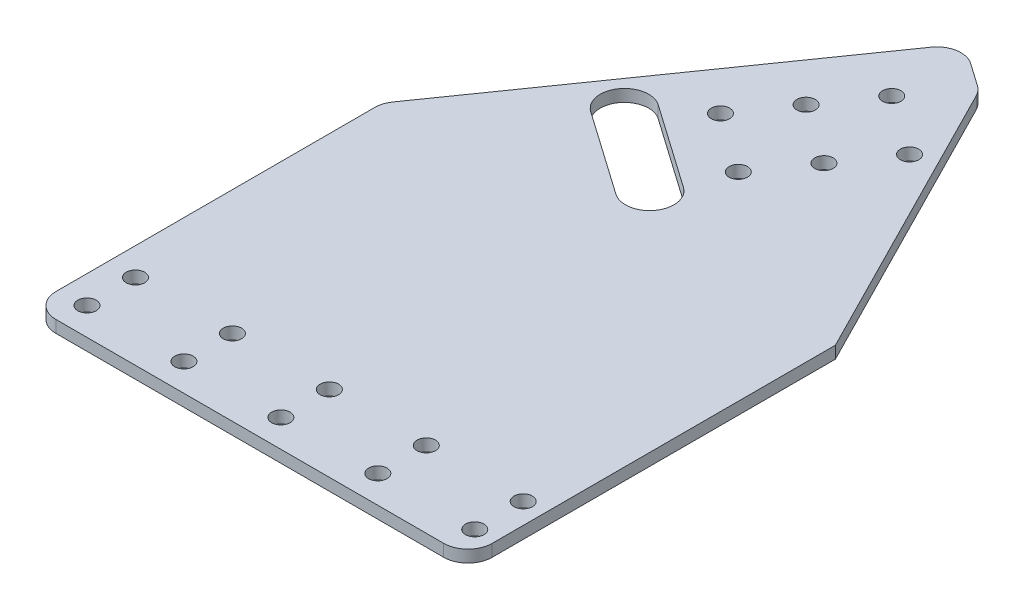
from build123d import *

# Parameters (mm, degrees)
SKETCH1_W           = 114.3
SKETCH1_H           = 181.61
BOSS_EXTRUDE1_DEPTH = 3.175
SKETCH2_R           = 2.413
CUT_EXTRUDE1_DEPTH  = 215.608393883
CUT_EXTRUDE3_DEPTH  = 215.608393883
CUT_EXTRUDE4_DEPTH  = 215.608393883
SKETCH3_R           = 2.413
CUT_EXTRUDE2_DEPTH  = 215.608393883
CUT_EXTRUDE5_DEPTH  = 215.608393883
FILLET1_R           = 6.35


with BuildPart() as part:
    # Sketch1 → Boss-Extrude1 (new body)
    with BuildSketch(Plane(origin=(0, 0, 0), x_dir=(1, 0, 0), z_dir=(0, 1, 0))):
        with Locations((57.15, 90.805)):
            Rectangle(SKETCH1_W, SKETCH1_H)
    extrude(amount=BOSS_EXTRUDE1_DEPTH)

    # Sketch2 → Cut-Extrude1 (cut, through all)
    with BuildSketch(Plane(origin=(0, 3.175, 0), x_dir=(1, 0, 0), z_dir=(0, 1, 0))):
        with Locations((7.239, 7.239)):
            Circle(SKETCH2_R)
        with Locations((7.239, 19.939)):
            Circle(SKETCH2_R)
        with Locations((32.639, 19.939)):
            Circle(SKETCH2_R)
        with Locations((58.039, 19.939)):
            Circle(SKETCH2_R)
        with Locations((83.439, 19.939)):
            Circle(SKETCH2_R)
        with Locations((108.839, 19.939)):
            Circle(SKETCH2_R)
        with Locations((32.639, 7.239)):
            Circle(SKETCH2_R)
        with Locations((58.039, 7.239)):
            Circle(SKETCH2_R)
        with Locations((83.439, 7.239)):
            Circle(SKETCH2_R)
        with Locations((108.839, 7.239)):
            Circle(SKETCH2_R)
    extrude(amount=-CUT_EXTRUDE1_DEPTH, mode=Mode.SUBTRACT)

    # Sketch4 → Cut-Extrude3 (cut, through all)
    with BuildSketch(Plane.XZ):
        Polygon((0, -181.61), (62.828519019, -181.61), (0, -91.881575796), align=None)
        Polygon((114.3, -145.569281014), (62.828519019, -181.61), (114.3, -181.61), align=None)
    extrude(amount=-CUT_EXTRUDE3_DEPTH, mode=Mode.SUBTRACT)

    # Sketch5 → Cut-Extrude4 (cut, through all)
    with BuildSketch(Plane.XZ):
        Polygon((75.39921929, -172.80790091), (114.3, -96.279640507), (114.3, -145.569281014), align=None)
    extrude(amount=-CUT_EXTRUDE4_DEPTH, mode=Mode.SUBTRACT)

    # Sketch3 → Cut-Extrude2 (cut, through all)
    with BuildSketch(Plane.XZ):
        with Locations((65.131472201, -160.203910247)):
            Circle(SKETCH3_R)
        with Locations((55.889406028, -147.004871864)):
            Circle(SKETCH3_R)
        with Locations((46.647339855, -133.80583348)):
            Circle(SKETCH3_R)
        with Locations((71.494252472, -136.078240751)):
            Circle(SKETCH3_R)
        with Locations((62.252186299, -122.879202368)):
            Circle(SKETCH3_R)
        with Locations((80.736318645, -149.277279134)):
            Circle(SKETCH3_R)
    extrude(amount=-CUT_EXTRUDE2_DEPTH, mode=Mode.SUBTRACT)

    # Sketch6 → Cut-Extrude5 (cut, through all)
    with BuildSketch(Plane.XZ):
        with BuildLine():
            Line((58.586824048, -112.175552546), (36.531974408, -127.618524518))
            ThreePointArc((36.531974408, -127.618524518), (27.688148556, -126.059119407), (29.247553666, -117.215293555))
            Line((29.247553666, -117.215293555), (51.302403307, -101.772321583))
            ThreePointArc((51.302403307, -101.772321583), (60.146229159, -103.331726693), (58.586824048, -112.175552546))
        make_face()
    extrude(amount=-CUT_EXTRUDE5_DEPTH, mode=Mode.SUBTRACT)

    # Fillet1
    fillet1_edges = [part.edges().sort_by_distance(p)[0] for p in [
        (0, 1.5875, -91.881575796),
        (75.39921929, 1.5875, -172.80790091),
        (62.828519019, 1.5875, -181.61),
        (0, 1.5875, 0),
        (114.3, 1.5875, 0),
    ]]
    fillet(fillet1_edges, radius=FILLET1_R)


solid = part.part
